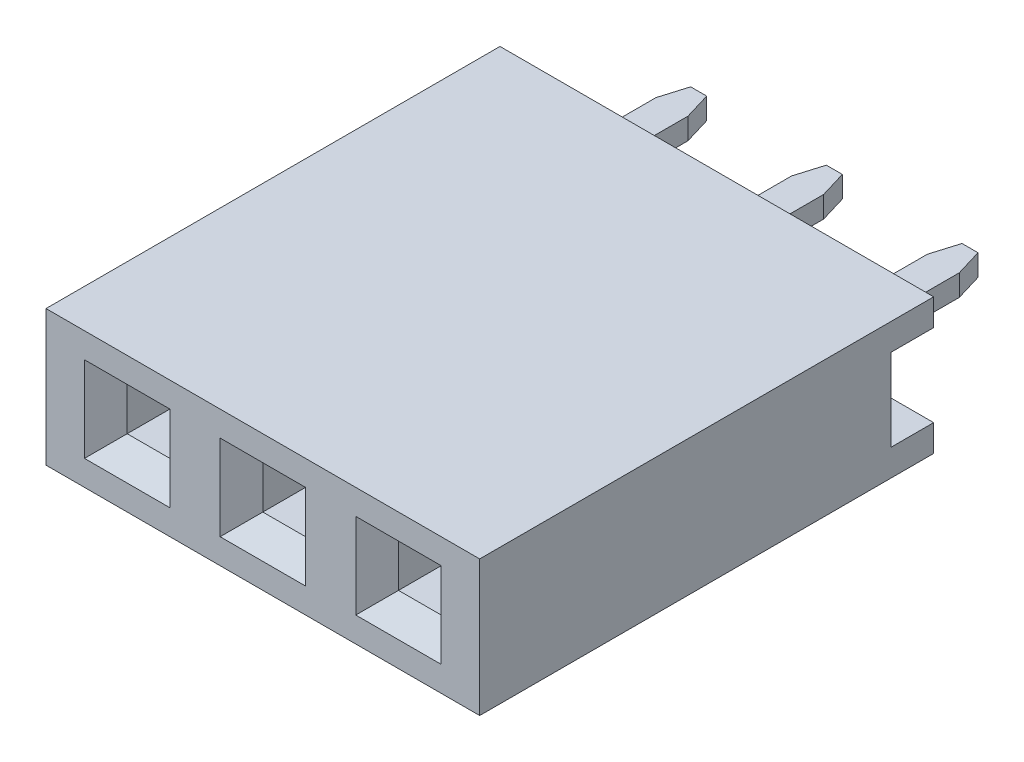
from build123d import *

# Parameters (mm, degrees)
SKETCH1_W           = 2.54
SKETCH1_H           = 8.5
BOSS_EXTRUDE1_DEPTH = 1.52
SKETCH_1_W          = 0.8
SKETCH_1_H          = 1.54
CUT_EXTRUDE_1_DEPTH = 10.116166958
SKETCH2_W           = 0.8
SKETCH2_H           = 0.8
CUT_EXTRUDE1_DEPTH  = 7
CHAMFER_1_SIZE      = 0.4
BOSS_EXTRUDE2_DEPTH = 0.2
LPATTERN1_COUNT     = 3
LPATTERN1_PITCH     = 2.54


with BuildPart() as part:
    # Sketch1 → Boss-Extrude1 (new, symmetric)
    with BuildSketch(Plane(origin=(0, 0, 0), x_dir=(0, -1, 0), z_dir=(1, 0, 0))):
        with Locations((0, -4.25)):
            Rectangle(SKETCH1_W, SKETCH1_H)
    extrude(amount=BOSS_EXTRUDE1_DEPTH, both=True)

    # Эскиз1 → Вырез-Вытянуть1 (cut, through all)
    with BuildSketch(Plane(origin=(1.52, 0, 0), x_dir=(0, 0, -1), z_dir=(1, 0, 0))):
        with Locations((-0.4, 0)):
            Rectangle(SKETCH_1_W, SKETCH_1_H)
    extrude(amount=-CUT_EXTRUDE_1_DEPTH, mode=Mode.SUBTRACT)

    # Sketch2 → Cut-Extrude1 (cut)
    with BuildSketch(Plane(origin=(0, 0, 8.5), x_dir=(-1, 0, 0), z_dir=(0, 0, 1))):
        Rectangle(SKETCH2_W, SKETCH2_H)
    extrude(amount=-CUT_EXTRUDE1_DEPTH, mode=Mode.SUBTRACT)

    # Фаска1
    chamfer_1_edges = [part.edges().sort_by_distance(p)[0] for p in [
        (0, -0.4, 8.5),
        (0.4, 0, 8.5),
        (0, 0.4, 8.5),
        (-0.4, 0, 8.5),
    ]]
    chamfer(chamfer_1_edges, length=CHAMFER_1_SIZE)

    # Sketch3 → Boss-Extrude2 (add, symmetric)
    with BuildSketch(Plane(origin=(0, 0, 0), x_dir=(1, 0, 0), z_dir=(0, 1, 0))):
        Polygon((-0.3, 0), (-0.3, 1.7), (-0.15, 2.2), (0.15, 2.2), (0.3, 1.7), (0.3, 0), (0.3, -0.8), (-0.3, -0.8), align=None)
        Polygon((0.4, -1.5), (-0.4, -1.5), (-0.4, -6.9), (-0.3, -6.9), (-0.3, -1.6), (0.3, -1.6), (0.3, -6.9), (0.4, -6.9), align=None)
    extrude(amount=BOSS_EXTRUDE2_DEPTH, both=True)


with BuildPart() as lpattern1_1:
    # LPattern1: pattern copy
    add(part.part.moved(Location(Vector(1, 0, 0) * (1 * LPATTERN1_PITCH))))


with BuildPart() as lpattern1_2:
    # LPattern1: pattern copy
    add(part.part.moved(Location(Vector(1, 0, 0) * (2 * LPATTERN1_PITCH))))

    # Combine 1: union LPattern1_1, part
    add(lpattern1_1.part)
    add(part.part)


solid = lpattern1_2.part
